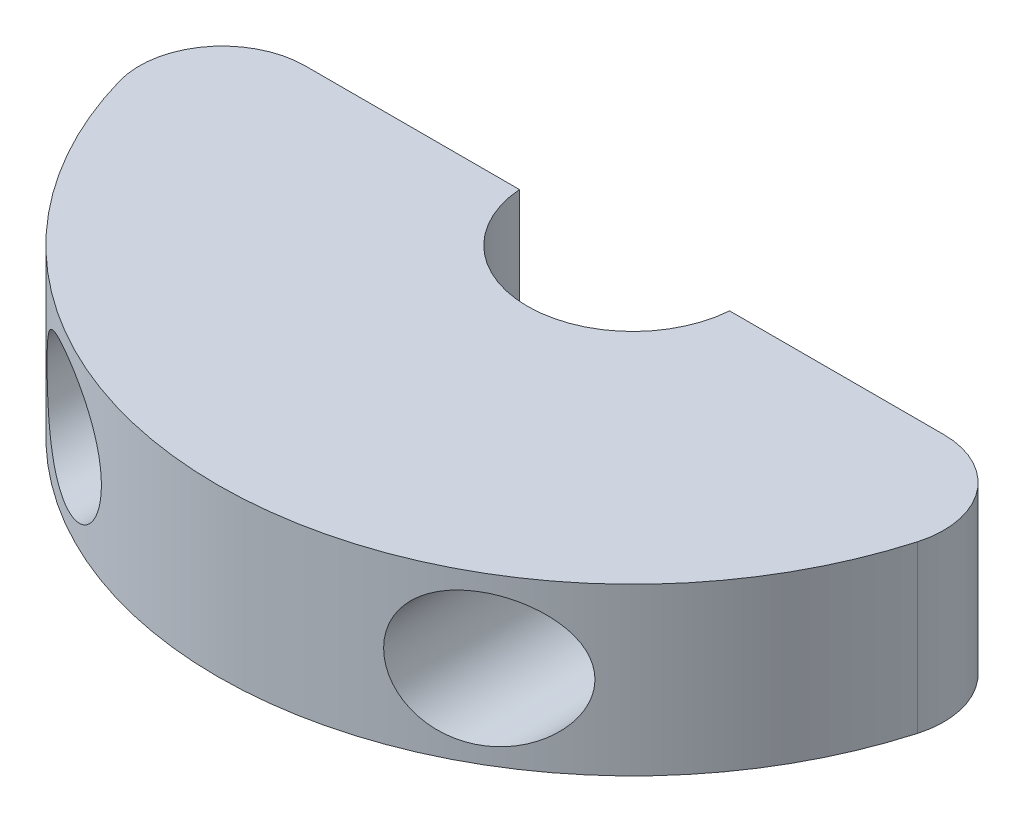
from build123d import *

# Parameters (mm, degrees)
BOSS_EXTRUDE1_DEPTH = 10
FILLET1_R           = 5
SKETCH2_R           = 1.5
CUT_EXTRUDE1_DEPTH  = 36.878807745
CUT_EXTRUDE2_START  = -10
SKETCH2_3_R         = 4
SKETCH2_3_R_2       = 1.5
CUT_EXTRUDE2_DEPTH  = 26.878807842


with BuildPart() as part:
    # Sketch1 → Boss-Extrude1 (new body)
    with BuildSketch(Plane(origin=(0, 0, 0), x_dir=(1, 0, 0), z_dir=(0, 1, 0))):
        with BuildLine():
            Line((-6.330284354, -50.5), (-24.9949995, -50.5))
            ThreePointArc((-24.9949995, -50.5), (0, -75), (24.9949995, -50.5))
            Line((24.9949995, -50.5), (6.330284354, -50.5))
            ThreePointArc((6.330284354, -50.5), (0, -56.35), (-6.330284354, -50.5))
        make_face()
    extrude(amount=BOSS_EXTRUDE1_DEPTH)

    # Fillet1
    fillet1_edges = [part.edges().sort_by_distance(p)[0] for p in [
        (-24.9949995, 5, 50.5),
        (24.9949995, 5, 50.5),
    ]]
    fillet(fillet1_edges, radius=FILLET1_R)

    # Sketch2 → Cut-Extrude1 (cut, through all)
    with BuildSketch(Plane(origin=(0, 0, 50.5), x_dir=(-1, 0, 0), z_dir=(0, 0, -1))):
        with Locations((-12.5, 5)):
            Circle(SKETCH2_R)
        with Locations((12.5, 5)):
            Circle(SKETCH2_R)
    extrude(amount=-CUT_EXTRUDE1_DEPTH, mode=Mode.SUBTRACT)

    # Sketch2<3> → Cut-Extrude2 (cut, through all)
    # profile 1 of 2: a face of its own
    with BuildSketch(Plane(origin=(0, 0, 50.5), x_dir=(-1, 0, 0), z_dir=(0, 0, -1)).offset(CUT_EXTRUDE2_START)):
        with Locations((-12.5, 5)):
            Circle(SKETCH2_3_R)
        with Locations((-12.5, 5)):
            Circle(SKETCH2_3_R_2, mode=Mode.SUBTRACT)
    # profile 2 of 2: a face of its own
    with BuildSketch(Plane(origin=(0, 0, 50.5), x_dir=(-1, 0, 0), z_dir=(0, 0, -1)).offset(CUT_EXTRUDE2_START)):
        with Locations((12.5, 5)):
            Circle(SKETCH2_3_R)
        with Locations((12.5, 5)):
            Circle(SKETCH2_3_R_2, mode=Mode.SUBTRACT)
    extrude(amount=-CUT_EXTRUDE2_DEPTH, mode=Mode.SUBTRACT)


solid = part.part
